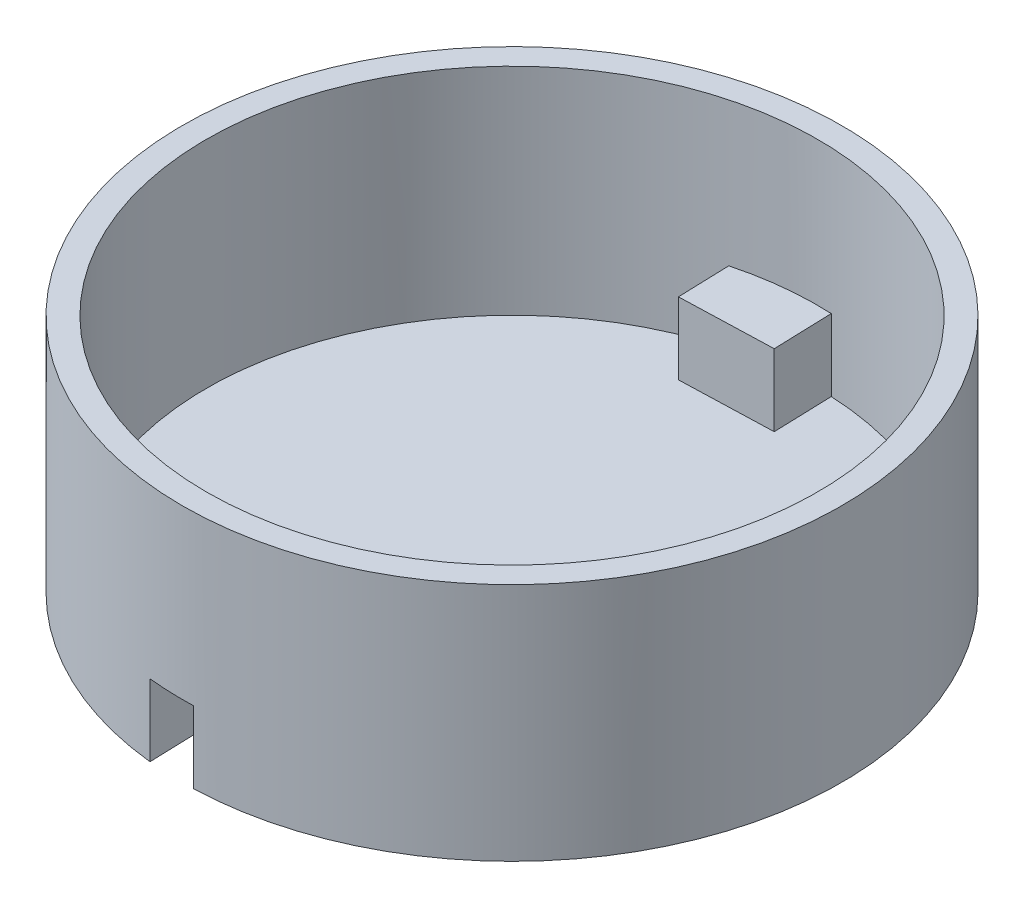
from build123d import *

# Parameters (mm, degrees)
CROQUIS1_R              = 27.5
SALIENTE_EXTRUIR1_DEPTH = 20
CORTAR_EXTRUIR1_DEPTH   = 6
VACIADO3_START          = 2
VACIADO3_DEPTH          = 18
VACIADO3_START_2        = 8
VACIADO3_2_DEPTH        = 12


# Read off the part's stored shape, not the designer's step: Vaciado3
with BuildPart() as part:
    # Croquis1 → Saliente-Extruir1 (new body)
    with BuildSketch(Plane(origin=(0, 0, 0), x_dir=(1, 0, 0), z_dir=(0, 1, 0))):
        with Locations(Location((0, 0, 0), (0, 0, 270))):
            Circle(CROQUIS1_R)
    extrude(amount=SALIENTE_EXTRUIR1_DEPTH)

    # Croquis2 → Cortar-Extruir1 (cut)
    with BuildSketch(Plane(origin=(0, 0, 0), x_dir=(-1, 0, 0), z_dir=(0, -1, 0))):
        with BuildLine():
            Line((3.016301233, -22.610051457), (2.862051808, -27.350661042))
            ThreePointArc((2.862051808, -27.350661042), (0.986172274, -27.482311843), (-0.894318642, -27.485454229))
            Line((-0.894318642, -27.485454229), (-0.731715252, -22.488098915))
            Line((-0.731715252, -22.488098915), (3.016301233, -22.610051457))
        make_face()
        with BuildLine():
            Line((0.731715252, 22.488098915), (4.479731738, 22.366146372))
            Line((4.479731738, 22.366146372), (4.633981164, 27.106755958))
            ThreePointArc((4.633981164, 27.106755958), (2.770627687, 27.360073505), (0.894318642, 27.485454229))
            Line((0.894318642, 27.485454229), (0.731715252, 22.488098915))
        make_face()
    extrude(amount=-CORTAR_EXTRUIR1_DEPTH, mode=Mode.SUBTRACT)

    # Vaciado3 outline → Vaciado3 (cut)
    with BuildSketch(Plane(origin=(0, 0, 0), x_dir=(1, 0, 0), z_dir=(0, 1, 0)).offset(VACIADO3_START)):
        with BuildLine():
            ThreePointArc((2.825664836, -25.342959934), (25.486512103, 0.829277286), (1.172219416, 25.473042646))
            Line((1.172219416, 25.473042646), (1.332268229, 20.554198145))
            Line((1.332268229, 20.554198145), (-6.413632508, 20.302162891))
            Line((-6.413632508, 20.302162891), (-6.554878223, 24.643124223))
            ThreePointArc((-6.554878223, 24.643124223), (-25.486512103, -0.829277286), (-4.939039, -25.017112019))
            Line((-4.939039, -25.017112019), (-5.080284715, -20.676150687))
            Line((-5.080284715, -20.676150687), (2.665616022, -20.424115433))
            Line((2.665616022, -20.424115433), (2.825664836, -25.342959934))
        make_face()
    extrude(amount=VACIADO3_DEPTH, mode=Mode.SUBTRACT)

    # Vaciado3 2 outline → Vaciado3 2 (cut)
    with BuildSketch(Plane(origin=(0, 0, 0), x_dir=(1, 0, 0), z_dir=(0, 1, 0)).offset(VACIADO3_START_2)):
        with BuildLine():
            Line((1.332268229, 20.554198145), (1.172219416, 25.473042646))
            ThreePointArc((1.172219416, 25.473042646), (-2.723131489, 25.354182197), (-6.554878223, 24.643124223))
            Line((-6.554878223, 24.643124223), (-6.413632508, 20.302162891))
            Line((-6.413632508, 20.302162891), (1.332268229, 20.554198145))
        make_face()
        with BuildLine():
            ThreePointArc((-4.939039, -25.017112019), (-1.069173421, -25.477575791), (2.825664836, -25.342959934))
            Line((2.825664836, -25.342959934), (2.665616022, -20.424115433))
            Line((2.665616022, -20.424115433), (-5.080284715, -20.676150687))
            Line((-5.080284715, -20.676150687), (-4.939039, -25.017112019))
        make_face()
    extrude(amount=VACIADO3_2_DEPTH, mode=Mode.SUBTRACT)


solid = part.part
